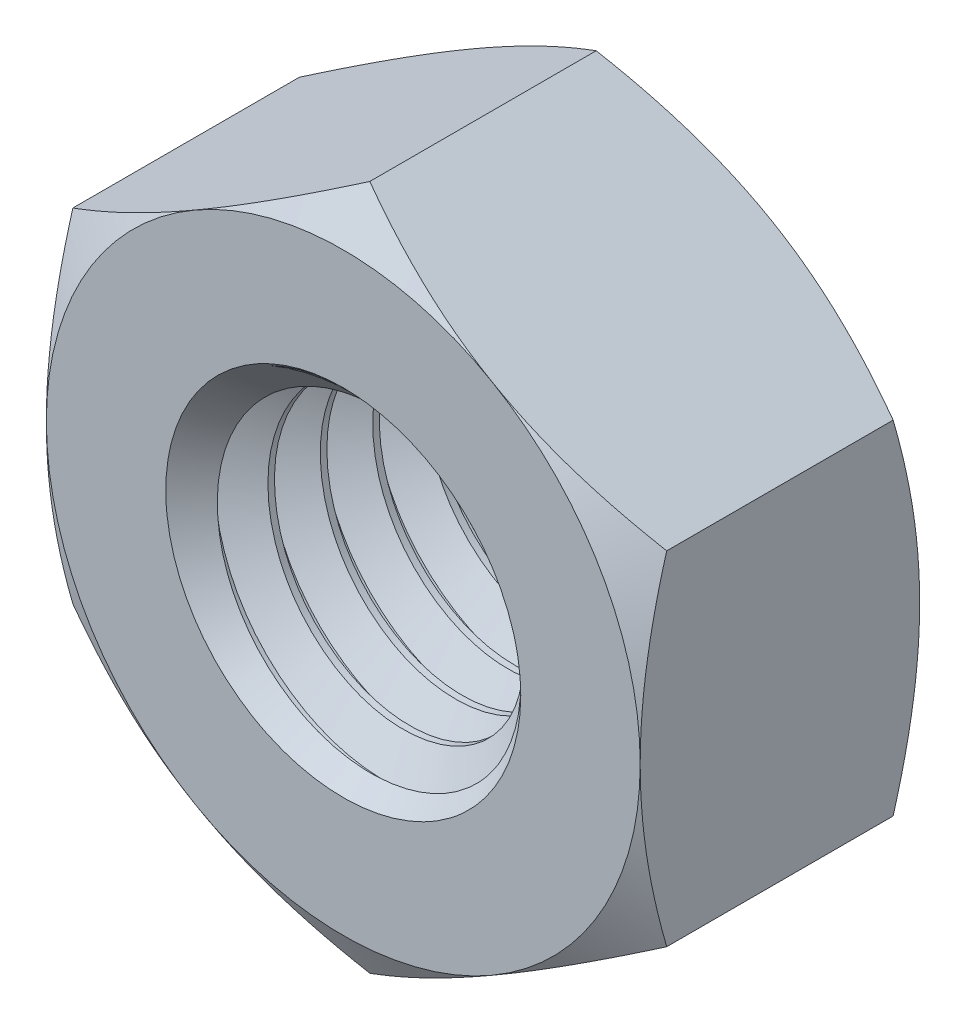
from build123d import *

# Parameters (mm, degrees)
BOSS_EXTRUDE1_DEPTH      = 4
BOSS_EXTRUDE1_DEPTH_BACK = 4
SKETCH2_R                = 5
SKETCH3_OUTSIDE_W        = 80.728
SKETCH3_OUTSIDE_H        = 83.358
SKETCH3_OUTSIDE_R        = 8.5
CUT_EXTRUDE1_DEPTH       = 16.250683045
CUT_EXTRUDE1_DRAFT       = -60
MIRROR1_COPY_1_SKETCH_W  = 80.728
MIRROR1_COPY_1_SKETCH_H  = 83.358
MIRROR1_COPY_1_SKETCH_R  = 8.5
MIRROR1_COPY_1_DEPTH     = 16.250683045
MIRROR1_COPY_1_DRAFT     = -60
SWEEP1_PITCH             = 1.5
SKETCH6_R                = 5.081189882
CUT_EXTRUDE2_DEPTH       = 17.116021817
SKETCH7_R                = 5.081189882
CUT_EXTRUDE3_DEPTH       = 16.250683153


with BuildPart() as part:
    # Sketch2 → Boss-Extrude1 (new, two sides: drawn at the far end of the back side and taken through both)
    with BuildSketch(Plane.XY.offset(-BOSS_EXTRUDE1_DEPTH_BACK)):
        Polygon((0, 9.814954576), (-8.5, 4.907477288), (-8.5, -4.907477288), (0, -9.814954576), (8.5, -4.907477288), (8.5, 4.907477288), align=None)
        Circle(SKETCH2_R, mode=Mode.SUBTRACT)
    extrude(amount=BOSS_EXTRUDE1_DEPTH + BOSS_EXTRUDE1_DEPTH_BACK)


with BuildPart() as cut_extrude1_tool:
    # Sketch3 outside → Cut-Extrude1 (with draft: the straight prism first)
    with BuildSketch(Plane.XY.offset(4)):
        Rectangle(SKETCH3_OUTSIDE_W, SKETCH3_OUTSIDE_H)
        Circle(SKETCH3_OUTSIDE_R, mode=Mode.SUBTRACT)
    extrude(amount=-CUT_EXTRUDE1_DEPTH)
    # Cut-Extrude1: the draft: its side faces are tilted about the plane it starts from
    cut_extrude1_sides = [cut_extrude1_tool.faces().sort_by_distance(p)[0] for p in [
        (0, -41.679, -4.125341522),
        (40.364, 0, -4.125341522),
        (0, 41.679, -4.125341522),
        (-40.364, 0, -4.125341522),
        (-8.5, 0, -4.125341522),
    ]]
    draft(cut_extrude1_sides, Plane.XY.offset(4), CUT_EXTRUDE1_DRAFT)


with BuildPart() as part_1:
    add(part.part)

    # Cut-Extrude1: cut by cut_extrude1_tool
    add(cut_extrude1_tool.part, mode=Mode.SUBTRACT)


with BuildPart() as mirror1_copy_1_tool:
    # Mirror1 copy 1 sketch → Mirror1 copy 1 (with draft: the straight prism first)
    with BuildSketch(Plane(origin=(0, 0, -4), x_dir=(1, 0, 0), z_dir=(0, 0, -1))):
        Rectangle(MIRROR1_COPY_1_SKETCH_W, MIRROR1_COPY_1_SKETCH_H)
        Circle(MIRROR1_COPY_1_SKETCH_R, mode=Mode.SUBTRACT)
    extrude(amount=-MIRROR1_COPY_1_DEPTH)
    # Mirror1 copy 1: the draft: its side faces are tilted about the plane it starts from
    mirror1_copy_1_sides = [mirror1_copy_1_tool.faces().sort_by_distance(p)[0] for p in [
        (0, -41.679, 4.125341522),
        (40.364, 0, 4.125341522),
        (0, 41.679, 4.125341522),
        (-40.364, 0, 4.125341522),
        (-8.5, 0, 4.125341522),
    ]]
    draft(mirror1_copy_1_sides, Plane(origin=(0, 0, -4), x_dir=(1, 0, 0), z_dir=(0, 0, -1)), MIRROR1_COPY_1_DRAFT)


with BuildPart() as part_2:
    add(part_1.part)

    # Mirror1 copy 1: cut by mirror1_copy_1_tool
    add(mirror1_copy_1_tool.part, mode=Mode.SUBTRACT)

    # Sweep1: the profile of Sketch4 screwed along a right-hand helix of 6.333333 turns, 8 arcs to a turn; built about Z, then put on its axis
    sweep1_z = Axis((0, 0, 0), (0, 0, 1))
    sweep1_corners = [(5.081189882, 0, -1.359375), (4.025721421, 0, -0.75), (4.025721421, 0, -0.5625), (5.081189882, 0, 0.046875)]
    with BuildLine(mode=Mode.PRIVATE) as sweep1_profile:
        Line(sweep1_corners[0], sweep1_corners[1])
        Line(sweep1_corners[1], sweep1_corners[2])
        Line(sweep1_corners[2], sweep1_corners[3])
        Line(sweep1_corners[3], sweep1_corners[0])
    sweep1_cap = Face(sweep1_profile.wire())
    sweep1_turn_angles = [0, 22.5, 45, 67.5, 90, 112.5, 135, 157.5, 180, 202.5, 225, 247.5, 270, 292.5, 315, 337.5, 360]
    sweep1_turn_weights = [1, 0.9238795325112867, 1, 0.9238795325112867, 1, 0.9238795325112867, 1, 0.9238795325112867, 1, 0.9238795325112867, 1, 0.9238795325112867, 1, 0.9238795325112867, 1, 0.9238795325112867, 1]
    sweep1_turn_rails = [Edge.make_bspline([Vector(p[0], p[1], 0).rotate(sweep1_z, sweep1_turn_angles[k]) / sweep1_turn_weights[k] + Vector(0, 0, p[2] + SWEEP1_PITCH * sweep1_turn_angles[k] / 360) for k in range(17)], [0, 0, 0, 1, 1, 2, 2, 3, 3, 4, 4, 5, 5, 6, 6, 7, 7, 8, 8, 8], 2, sweep1_turn_weights) for p in sweep1_corners]
    sweep1_turn_sides = [Face.make_surface_from_curves(sweep1_turn_rails[p[0]], sweep1_turn_rails[p[1]]) for p in [(0, 1), (1, 2), (2, 3), (3, 0)]]
    sweep1_last_angles = [2160, 2182.5, 2205, 2227.5, 2250, 2265, 2280]
    sweep1_last_weights = [1, 0.9238795325112867, 1, 0.9238795325112867, 1, 0.9659258262890396, 1]
    sweep1_last_rails = [Edge.make_bspline([Vector(p[0], p[1], 0).rotate(sweep1_z, sweep1_last_angles[k]) / sweep1_last_weights[k] + Vector(0, 0, p[2] + SWEEP1_PITCH * sweep1_last_angles[k] / 360) for k in range(7)], [0, 0, 0, 1, 1, 2, 2, 3, 3, 3], 2, sweep1_last_weights) for p in sweep1_corners]
    sweep1_last_sides = [Face.make_surface_from_curves(sweep1_last_rails[p[0]], sweep1_last_rails[p[1]]) for p in [(0, 1), (1, 2), (2, 3), (3, 0)]]
    sweep1 = Plane(origin=(0, 0, 4), x_dir=(0, 1, 0), z_dir=(0, 0, -1)) * Solid(Shell([*[p.moved(Location((0, 0, SWEEP1_PITCH * i))) for i in range(6) for p in sweep1_turn_sides], *sweep1_last_sides, sweep1_cap, sweep1_cap.rotate(sweep1_z, 2280).moved(Location((0, 0, SWEEP1_PITCH * 2280 / 360)))]))
    add(sweep1)

    # Sketch6 → Cut-Extrude2 (cut)
    with BuildSketch(Plane.XY.offset(4)):
        Circle(SKETCH6_R)
    extrude(amount=CUT_EXTRUDE2_DEPTH, mode=Mode.SUBTRACT)

    # Cut-Extrude2 cone 1 section (through the dimple's axis) → Cut-Extrude2 other way (revolve, cut)
    with BuildSketch(Plane(origin=(0, 0, 4), x_dir=(0, -1, 0), z_dir=(1, 0, 0))):
        Polygon((0, 0), (5.081189882, 0), (0, 5.081189882), align=None)
    revolve(axis=Axis((0, 0, 4), (0, 0, -1)), mode=Mode.SUBTRACT)

    # Sketch7 → Cut-Extrude3 (cut)
    with BuildSketch(Plane(origin=(0, 0, -4), x_dir=(-1, 0, 0), z_dir=(0, 0, -1))):
        Circle(SKETCH7_R)
    extrude(amount=CUT_EXTRUDE3_DEPTH, mode=Mode.SUBTRACT)

    # Cut-Extrude3 cone 1 section (through the dimple's axis) → Cut-Extrude3 other way (revolve, cut)
    with BuildSketch(Plane(origin=(0, 0, -4), x_dir=(0, 1, 0), z_dir=(1, 0, 0))):
        Polygon((0, 0), (5.081189882, 0), (0, 5.081189882), align=None)
    revolve(axis=Axis((0, 0, -4), (0, 0, 1)), mode=Mode.SUBTRACT)


solid = part_2.part
